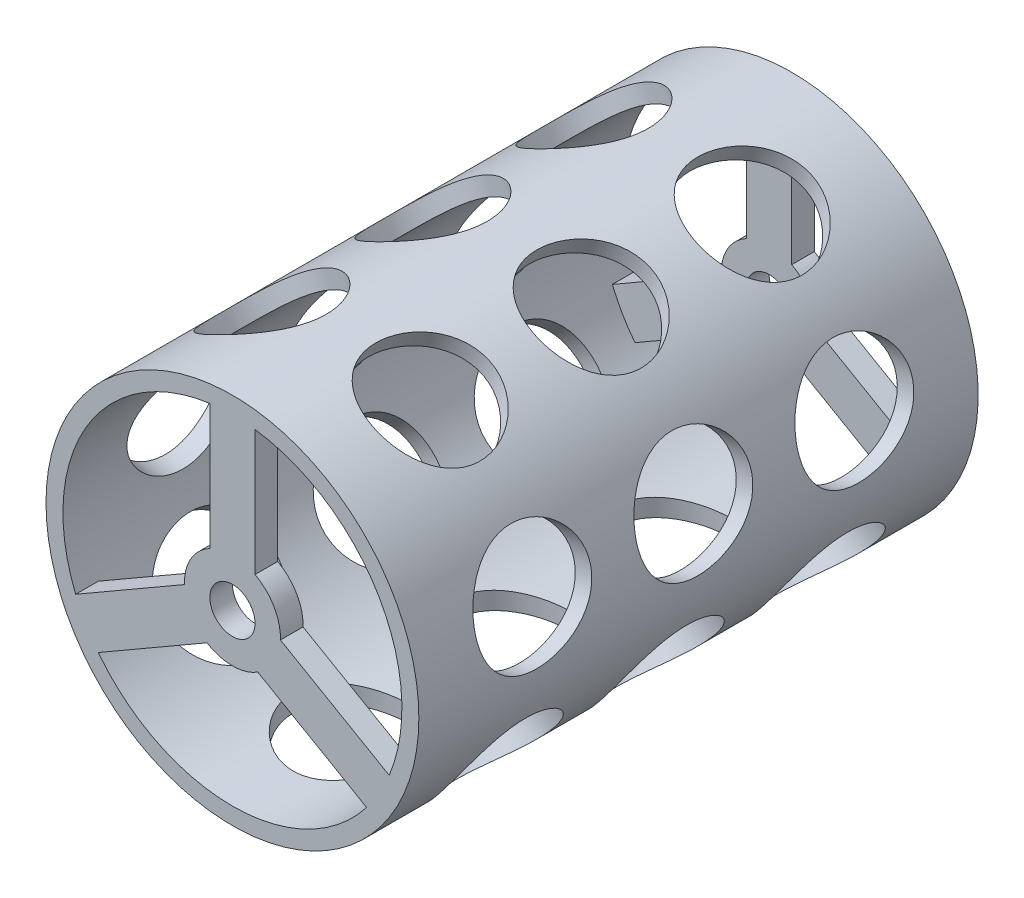
from build123d import *
from build123d.topology import SkipClean

# Parameters (mm, degrees)
IZIM1_R                     = 33
IZIM1_R_2                   = 30
Y_KSEKLIK_EKSTR_ZYON1_DEPTH = 95
Y_KSEKLIK_EKSTR_ZYON2_START = 4
IZIM2_R                     = 33
Y_KSEKLIK_EKSTR_ZYON2_DEPTH = 4
Y_KSEKLIK_EKSTR_ZYON3_START = -4
IZIM3_R                     = 33
Y_KSEKLIK_EKSTR_ZYON3_DEPTH = 4
KES_EKSTR_ZYON1_DEPTH       = 122
IZIM5_R                     = 4
KES_EKSTR_ZYON2_DEPTH       = 122
KES_EKSTR_ZYON3_START       = -75
IZIM6_R                     = 10.25
KES_EKSTR_ZYON3_DEPTH       = 81
DAIRESEL_KAPLAMA1_COUNT     = 7


with BuildPart() as part:
    # Çizim1 → Yükseklik-Ekstrüzyon1 (new body)
    with BuildSketch(Plane.XY):
        Circle(IZIM1_R)
        Circle(IZIM1_R_2, mode=Mode.SUBTRACT)
    extrude(amount=Y_KSEKLIK_EKSTR_ZYON1_DEPTH)

    # Çizim2 → Yükseklik-Ekstrüzyon2 (add)
    with BuildSketch(Plane(origin=(0, 0, 0), x_dir=(-1, 0, 0), z_dir=(0, 0, -1)).offset(Y_KSEKLIK_EKSTR_ZYON2_START)):
        Circle(IZIM2_R)
    extrude(amount=-Y_KSEKLIK_EKSTR_ZYON2_DEPTH)

    # Çizim3 → Yükseklik-Ekstrüzyon3 (add)
    with BuildSketch(Plane.XY.offset(95).offset(Y_KSEKLIK_EKSTR_ZYON3_START)):
        Circle(IZIM3_R)
    extrude(amount=Y_KSEKLIK_EKSTR_ZYON3_DEPTH)

    # Çizim4 → Kes-Ekstrüzyon1 (cut)
    with BuildSketch(Plane(origin=(0, 0, -4), x_dir=(-1, 0, 0), z_dir=(0, 0, -1))):
        with BuildLine():
            ThreePointArc((4, 7.5), (7.361215932, 4.25), (8.495190528, -0.285898385))
            Line((8.495190528, -0.285898385), (27.748786379, -11.401967132))
            ThreePointArc((27.748786379, -11.401967132), (25.980762114, 15), (4, 29.732137495))
            Line((4, 29.732137495), (4, 7.5))
        make_face()
        with BuildLine():
            Line((-4, 7.5), (-4, 29.732137495))
            ThreePointArc((-4, 29.732137495), (-25.980762114, 15), (-27.748786379, -11.401967132))
            Line((-27.748786379, -11.401967132), (-8.495190528, -0.285898385))
            ThreePointArc((-8.495190528, -0.285898385), (-7.361215932, 4.25), (-4, 7.5))
        make_face()
        with BuildLine():
            ThreePointArc((-23.748786379, -18.330170362), (0, -30), (23.748786379, -18.330170362))
            Line((23.748786379, -18.330170362), (4.495190528, -7.214101615))
            ThreePointArc((4.495190528, -7.214101615), (0, -8.5), (-4.495190528, -7.214101615))
            Line((-4.495190528, -7.214101615), (-23.748786379, -18.330170362))
        make_face()
    extrude(amount=-KES_EKSTR_ZYON1_DEPTH, mode=Mode.SUBTRACT)

    # Çizim5 → Kes-Ekstrüzyon2 (cut)
    with BuildSketch(Plane(origin=(0, 0, -4), x_dir=(-1, 0, 0), z_dir=(0, 0, -1))):
        Circle(IZIM5_R)
    extrude(amount=-KES_EKSTR_ZYON2_DEPTH, mode=Mode.SUBTRACT)

    # Çizim6 → Kes-Ekstrüzyon3 (cut)
    with SkipClean():  # the faces are left unmerged after this step: merging them gives an invalid solid
        with BuildSketch(Plane(origin=(0, 0, 0), x_dir=(1, 0, 0), z_dir=(0, 1, 0)).offset(KES_EKSTR_ZYON3_START)):
            with Locations((0, -17)):
                Circle(IZIM6_R)
            with Locations((0, -45.5)):
                Circle(IZIM6_R)
            with Locations((0, -74)):
                Circle(IZIM6_R)
        kes_ekstr_zyon3 = extrude(amount=KES_EKSTR_ZYON3_DEPTH, mode=Mode.SUBTRACT)

    # Dairesel Kaplama1: Kes-Ekstrüzyon3 ×7 about axis
    dairesel_kaplama1_axis = Axis((0, 0, 91), (0, 0, 1))
    for i in range(1, DAIRESEL_KAPLAMA1_COUNT):
        add(kes_ekstr_zyon3.rotate(dairesel_kaplama1_axis, i * 360 / DAIRESEL_KAPLAMA1_COUNT), mode=Mode.SUBTRACT)


solid = part.part
